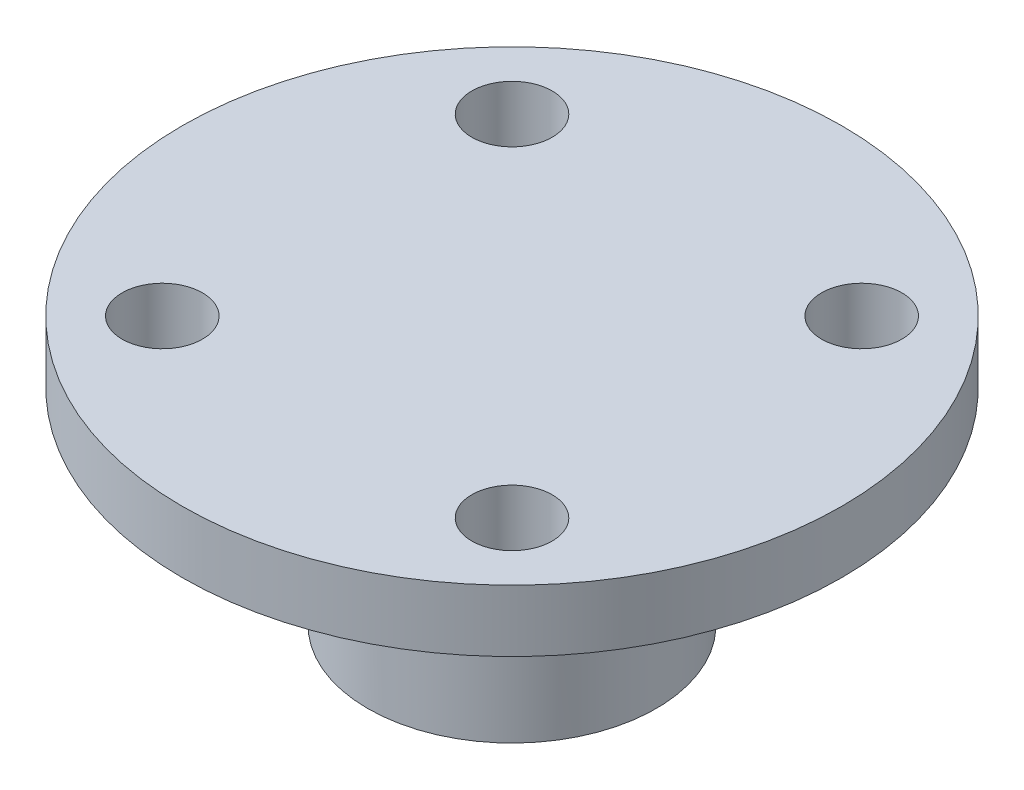
from build123d import *

# Parameters (mm, degrees)
SKETCH1_R             = 16
BOSS_EXTRUDE1_DEPTH   = 3
SKETCH6_R             = 7
BOSS_EXTRUDE2_DEPTH   = 10
SKETCH7_R             = 1
CUT_EXTRUDE1_DEPTH    = 10.5
CUT_EXTRUDE2_DEPTH    = 2
F_3_0MM_DOWEL_HOLE1_D = 3.9


with BuildPart() as part:
    # Sketch1 → Boss-Extrude1 (new body)
    with BuildSketch(Plane(origin=(0, 0, 0), x_dir=(1, 0, 0), z_dir=(0, 1, 0))):
        Circle(SKETCH1_R)
    extrude(amount=BOSS_EXTRUDE1_DEPTH)

    # Sketch6 → Boss-Extrude2 (add)
    with BuildSketch(Plane.XZ):
        Circle(SKETCH6_R)
        with BuildLine():
            Line((-2.645751311, 3), (2.645751311, 3))
            ThreePointArc((2.645751311, 3), (0, -4), (-2.645751311, 3))
        make_face(mode=Mode.SUBTRACT)
    extrude(amount=BOSS_EXTRUDE2_DEPTH)

    # Sketch7 → Cut-Extrude1 (cut)
    with BuildSketch(Plane.XY):
        with Locations((0, -5)):
            Circle(SKETCH7_R)
    extrude(amount=CUT_EXTRUDE1_DEPTH, mode=Mode.SUBTRACT)

    # Sketch11 → Cut-Extrude2 (cut)
    with BuildSketch(Plane.XY.offset(7)):
        with BuildLine():
            ThreePointArc((0, -3.1), (-1.343502884, -6.343502884), (1.9, -5))
            ThreePointArc((1.9, -5), (1.343502884, -3.656497116), (0, -3.1))
        make_face()
    extrude(amount=-CUT_EXTRUDE2_DEPTH, mode=Mode.SUBTRACT)

    # Ø3.0mm Dowel Hole1 (through all)
    with Locations(Plane(origin=(8.485281374, 3, 8.485281374), x_dir=(0, 0, 1), z_dir=(0, 1, 0))):
        with Locations((0, 0), (0, -16.970562748), (-16.970562748, -16.970562748), (-16.970562748, 0)):
            Hole(F_3_0MM_DOWEL_HOLE1_D / 2)


solid = part.part
